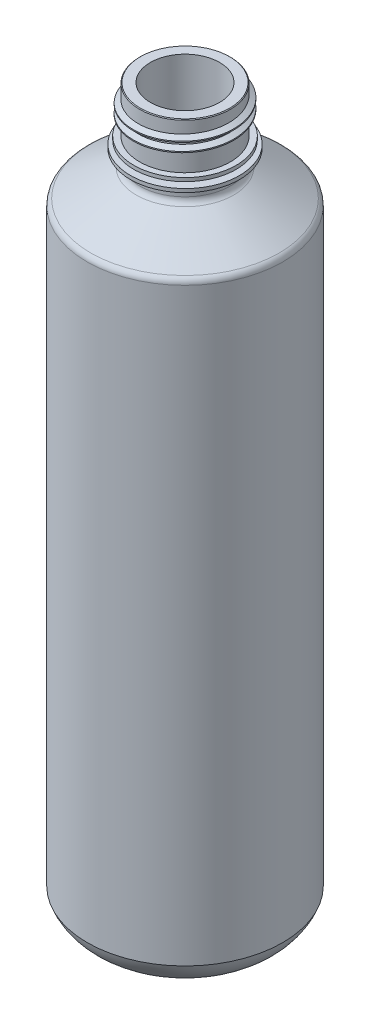
from build123d import *

# Parameters (mm, degrees)
FILLET5_R        = 2.54
FILLET6_R        = 5.08
FILLET9_R        = 5.08
SKETCH6_W        = 3.302
SKETCH6_H        = 1.27
SKETCH6_W_2      = 2.0955
FILLET10_R       = 1.524
THREAD1_PITCH    = 3.175
FILLET11_START   = 246
FILLET11_DEPTH   = 3.619083861
FILLET11_START_2 = 253.904749909
FILLET11_2_DEPTH = 3.095250091
CHAMFER1_SIZE    = 0.254


with BuildPart() as part:
    # Sketch4 → Revolve1 (revolve)
    with BuildSketch(Plane.XY, mode=Mode.PRIVATE) as revolve1_sk:
        with BuildLine():
            Line((34.925, 222.170378454), (34.925, 10.16))
            ThreePointArc((34.925, 10.16), (30.983124884, 3.985396487), (24.836522342, 0))
            Line((24.836522342, 0), (20.518522342, 0))
            ThreePointArc((20.518522342, 0), (10.436266832, 3.254939883), (0, 5.08))
            Line((0, 5.08), (0, 76.621544941))
            Line((0, 76.621544941), (0, 258.826))
            Line((0, 258.826), (16.1925, 258.826))
            Line((16.1925, 258.826), (16.1925, 233.426))
            Line((16.1925, 233.426), (34.925, 222.170378454))
        make_face()
    revolve(revolve1_sk.sketch.rotate(Axis((0, 76.621544941, 0), (0, 1, 0)), 90), axis=Axis((0, 76.621544941, 0), (0, 1, 0)))

    # Fillet5
    fillet5_edges = [part.edges().sort_by_distance(p)[0] for p in [
        (0, 222.170378454, 34.925),
        (0, 233.426, 16.1925),
    ]]
    fillet(fillet5_edges, radius=FILLET5_R)

    # Fillet6
    fillet6_edges = [part.edges().sort_by_distance(p)[0] for p in [
        (0, 0, 24.836522342),
    ]]
    fillet(fillet6_edges, radius=FILLET6_R)

    # Shell2: read off the stored shape, not the designer's step
    # Shell2 outline → Shell2 (revolve, cut)
    with BuildSketch(Plane.XY):
        with BuildLine():
            Line((0, 258.826), (0, 8.909534231))
            add(Edge.make_bspline(
                [(0, 8.909534231), (2.497980727, 8.662422458), (4.993008779, 8.316681522), (7.477257227, 7.872021335), (9.942956443, 7.329355818), (14.189811269, 6.217803876), (15.982781545, 5.692156808), (17.758331872, 5.114772944), (19.513530428, 4.486872499), (21.245608078, 3.81)],
                knots=[4.810992779, 4.810992779, 4.810992779, 4.810992779, 4.810992779, 4.810992779, 4.968350571, 4.968350571, 4.968350571, 4.968350571, 5.084927507, 5.084927507, 5.084927507, 5.084927507, 5.084927507, 5.084927507], degree=5, weights=[1, 1, 0.999996219, 0.999996184, 1, 1, 0.99999886, 0.999998871, 1, 1]))
            Line((21.245608078, 3.81), (23.824162295, 3.81))
            ThreePointArc((23.824162295, 3.81), (24.095939998, 3.839420748), (24.355125728, 3.926319874))
            ThreePointArc((24.355125728, 3.926319874), (28.38391709, 6.776218245), (31.115, 10.886481827))
            Line((31.115, 10.886481827), (31.115, 220.014784169))
            Line((31.115, 220.014784169), (15.462008224, 229.420050497))
            ThreePointArc((15.462008224, 229.420050497), (13.205741331, 231.73617325), (12.3825, 234.863062857))
            Line((12.3825, 234.863062857), (12.3825, 258.826))
            Line((12.3825, 258.826), (0, 258.826))
        make_face()
    revolve(axis=Axis((0, 0, 0), (0, 1, 0)), mode=Mode.SUBTRACT)

    # Fillet9
    fillet9_edges = [part.edges().sort_by_distance(p)[0] for p in [
        (-21.245608078, 3.81, 0),
    ]]
    fillet(fillet9_edges, radius=FILLET9_R)

    # Sketch6 → Revolve6 (revolve)
    with BuildSketch(Plane.XY, mode=Mode.PRIVATE) as revolve6_sk:
        with Locations((17.8435, 239.141)):
            Rectangle(SKETCH6_W, SKETCH6_H)
        with Locations((17.24025, 241.681)):
            Rectangle(SKETCH6_W_2, SKETCH6_H)
    revolve(revolve6_sk.sketch.rotate(Axis((0, 260.35, 0), (0, -1, 0)), 270), axis=Axis((0, 260.35, 0), (0, -1, 0)))

    # Fillet10
    fillet10_edges = [part.edges().sort_by_distance(p)[0] for p in [
        (0, 238.506, 16.1925),
    ]]
    fillet(fillet10_edges, radius=FILLET10_R)

    # Thread1: arcs per turn and ends read off the stored shape
    # Thread1: the profile of Thread Profile1 profile screwed along a right-hand helix through 2.1 turns, 12 arcs to a turn; built about Z, then put on its axis
    thread1_z = Axis((0, 0, 0), (0, 0, 1))
    thread1_corners = [(16.1922, 0, -0.000173205), (17.911019153, 0, 0.992187496), (17.911019153, 0, 1.389062496), (16.1922, 0, 2.381423196)]
    with BuildLine(mode=Mode.PRIVATE) as thread1_profile:
        Line(thread1_corners[0], thread1_corners[1])
        Line(thread1_corners[1], thread1_corners[2])
        Line(thread1_corners[2], thread1_corners[3])
        Line(thread1_corners[3], thread1_corners[0])
    thread1_cap = Face(thread1_profile.wire())
    thread1_turn_angles = [0, 15, 30, 45, 60, 75, 90, 105, 120, 135, 150, 165, 180, 195, 210, 225, 240, 255, 270, 285, 300, 315, 330, 345, 360]
    thread1_turn_weights = [1, 0.9659258262890683, 1, 0.9659258262890683, 1, 0.9659258262890683, 1, 0.9659258262890683, 1, 0.9659258262890683, 1, 0.9659258262890683, 1, 0.9659258262890683, 1, 0.9659258262890683, 1, 0.9659258262890683, 1, 0.9659258262890683, 1, 0.9659258262890683, 1, 0.9659258262890683, 1]
    thread1_turn_rails = [Edge.make_bspline([Vector(p[0], p[1], 0).rotate(thread1_z, thread1_turn_angles[k]) / thread1_turn_weights[k] + Vector(0, 0, p[2] + THREAD1_PITCH * thread1_turn_angles[k] / 360) for k in range(25)], [0, 0, 0, 1, 1, 2, 2, 3, 3, 4, 4, 5, 5, 6, 6, 7, 7, 8, 8, 9, 9, 10, 10, 11, 11, 12, 12, 12], 2, thread1_turn_weights) for p in thread1_corners]
    thread1_turn_sides = [Face.make_surface_from_curves(thread1_turn_rails[p[0]], thread1_turn_rails[p[1]]) for p in [(0, 1), (1, 2), (2, 3), (3, 0)]]
    thread1_last_angles = [720, 735, 750, 753, 756]
    thread1_last_weights = [1, 0.9659258262890683, 1, 0.9986295347545738, 1]
    thread1_last_rails = [Edge.make_bspline([Vector(p[0], p[1], 0).rotate(thread1_z, thread1_last_angles[k]) / thread1_last_weights[k] + Vector(0, 0, p[2] + THREAD1_PITCH * thread1_last_angles[k] / 360) for k in range(5)], [0, 0, 0, 1, 1, 2, 2, 2], 2, thread1_last_weights) for p in thread1_corners]
    thread1_last_sides = [Face.make_surface_from_curves(thread1_last_rails[p[0]], thread1_last_rails[p[1]]) for p in [(0, 1), (1, 2), (2, 3), (3, 0)]]
    thread1 = Plane(origin=(0, 256.286, 0), x_dir=(-1, 0, 0), z_dir=(0, -1, 0)) * Solid(Shell([*[p.moved(Location((0, 0, THREAD1_PITCH * i))) for i in range(2) for p in thread1_turn_sides], *thread1_last_sides, thread1_cap, thread1_cap.rotate(thread1_z, 756).moved(Location((0, 0, THREAD1_PITCH * 756 / 360)))]))
    add(thread1)

    # Fillet11: read off the stored shape, not the designer's step
    # Fillet11 outline → Fillet11 (cut)
    with BuildSketch(Plane(origin=(0, 0, 0), x_dir=(1, 0, 0), z_dir=(0, 1, 0)).offset(FILLET11_START)):
        with BuildLine():
            Line((-17.054980273, 5.541507897), (-16.741925256, 6.364946646))
            ThreePointArc((-16.741925256, 6.364946646), (-15.31841255, 8.400450192), (-13.099998704, 9.517725054))
            Line((-13.099998704, 9.517725054), (-14.490318881, 10.527832912))
            Line((-14.490318881, 10.527832912), (-15.502179952, 11.262979273))
            Line((-15.502179952, 11.262979273), (-17.054980273, 5.541507897))
        make_face()
    extrude(amount=FILLET11_DEPTH, mode=Mode.SUBTRACT)

    # Fillet11 2 outline → Fillet11 2 (cut)
    with BuildSketch(Plane(origin=(0, 0, 0), x_dir=(1, 0, 0), z_dir=(0, 1, 0)).offset(FILLET11_START_2)):
        with BuildLine():
            Line((-17.285719396, 4.691323061), (-17.054980273, 5.541507897))
            Line((-17.054980273, 5.541507897), (-19, 0.425459527))
            Line((-19, 0.425459527), (-19, 0))
            Line((-19, 0), (-16.1925, 0))
            ThreePointArc((-16.1925, 0), (-17.330514733, 2.207846367), (-17.285719396, 4.691323061))
        make_face()
    extrude(amount=FILLET11_2_DEPTH, mode=Mode.SUBTRACT)

    # Chamfer1
    chamfer1_edges = [part.edges().sort_by_distance(p)[0] for p in [
        (0, 258.826, 16.1925),
    ]]
    chamfer(chamfer1_edges, length=CHAMFER1_SIZE)


solid = part.part
